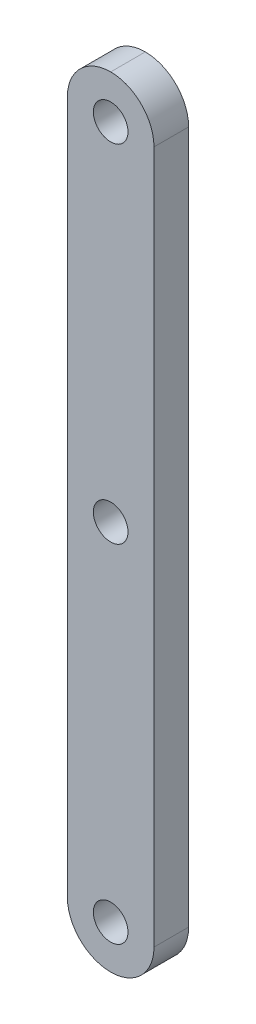
from build123d import *

# Parameters (mm, degrees)
ESQUISSE1_W             = 50
ESQUISSE1_H             = 450
BOSS_EXTRU_1_DEPTH      = 20
ENL_V_MAT_EXTRU_1_REACH = 229.266
ESQUISSE2_R             = 10
CONG_1_R                = 25


with BuildPart() as part:
    # Esquisse1 → Boss.-Extru.1 (new body)
    with BuildSketch(Plane.XY):
        Rectangle(ESQUISSE1_W, ESQUISSE1_H)
    extrude(amount=BOSS_EXTRU_1_DEPTH)

    # Esquisse2 → Enlèv. mat.-Extru.1 (cut, up to next)
    with BuildSketch(Plane.XY.offset(20), mode=Mode.PRIVATE) as enl_v_mat_extru_1_sk1:
        with Locations((0, -200)):
            Circle(ESQUISSE2_R)
    enl_v_mat_extru_1_tool1 = extrude(enl_v_mat_extru_1_sk1.sketch, amount=-ENL_V_MAT_EXTRU_1_REACH, mode=Mode.PRIVATE) & part.part
    # Esquisse2 → Enlèv. mat.-Extru.1 (cut, up to next)
    with BuildSketch(Plane.XY.offset(20), mode=Mode.PRIVATE) as enl_v_mat_extru_1_sk2:
        with Locations((0, 200)):
            Circle(ESQUISSE2_R)
    enl_v_mat_extru_1_tool2 = extrude(enl_v_mat_extru_1_sk2.sketch, amount=-ENL_V_MAT_EXTRU_1_REACH, mode=Mode.PRIVATE) & part.part
    # Esquisse2 → Enlèv. mat.-Extru.1 (cut, up to next)
    with BuildSketch(Plane.XY.offset(20), mode=Mode.PRIVATE) as enl_v_mat_extru_1_sk3:
        Circle(ESQUISSE2_R)
    enl_v_mat_extru_1_tool3 = extrude(enl_v_mat_extru_1_sk3.sketch, amount=-ENL_V_MAT_EXTRU_1_REACH, mode=Mode.PRIVATE) & part.part
    add(enl_v_mat_extru_1_tool1.solids().sort_by_distance((0, -200, 20))[0], mode=Mode.SUBTRACT)
    add(enl_v_mat_extru_1_tool2.solids().sort_by_distance((0, 200, 20))[0], mode=Mode.SUBTRACT)
    add(enl_v_mat_extru_1_tool3.solids().sort_by_distance((0, 0, 20))[0], mode=Mode.SUBTRACT)

    # Congé1
    cong_1_edges = [part.edges().sort_by_distance(p)[0] for p in [
        (-25, -225, 10),
        (25, -225, 10),
        (-25, 225, 10),
        (25, 225, 10),
    ]]
    fillet(cong_1_edges, radius=CONG_1_R - 0.0001)  # a hair under: the kernel refuses the full size


solid = part.part
